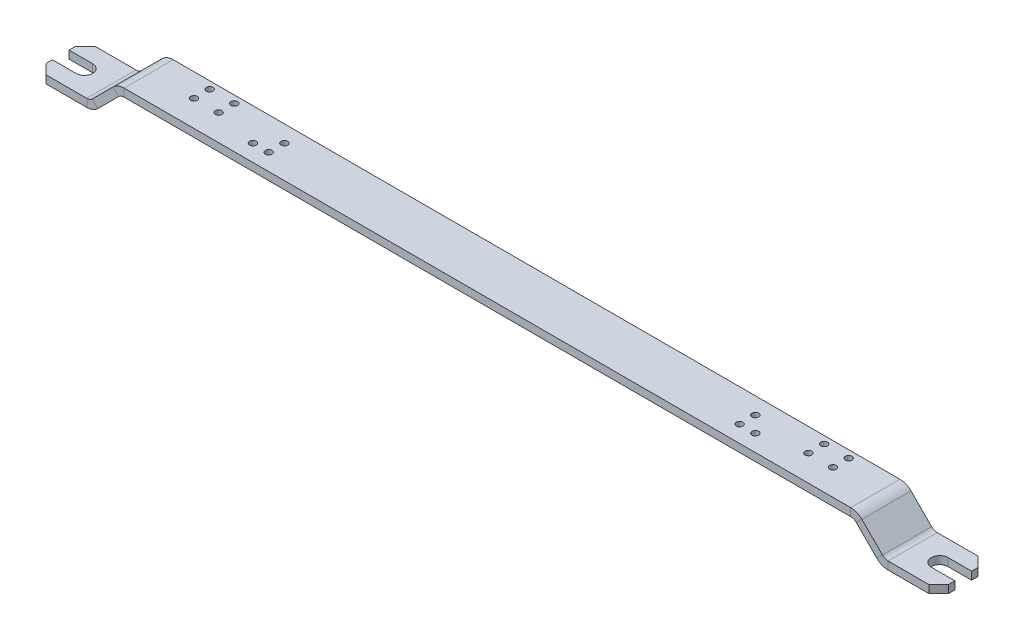
from build123d import *

# Parameters (mm, degrees)
SKETCH_1_W             = 459
SKETCH_1_H             = 50
SM_BASE_FLANGE_1_DEPTH = 8
OTHER_START            = -25
OTHER_1_DEPTH          = 50
OTHER_1_2_DEPTH        = 50
CHAMFER_1_SIZE         = 10
CUT_EXTRUDE_1_DEPTH    = 461.532300713
M8X1_251_D             = 6.8
M8X1_251_CSINK_D       = 8.5
M8X1_251_CSINK_ANGLE   = 90


# Read off the part's stored shape, not the designer's step: Изгиб1
# Sheet-metal steps are written as plain solids
with BuildPart() as part:
    # Sketch 1 → Базовая кромка1 (new body)
    with BuildSketch(Plane(origin=(0, 0, 0), x_dir=(1, 0, 0), z_dir=(0, 1, 0))):
        with Locations((-229.5, 0)):
            Rectangle(SKETCH_1_W, SKETCH_1_H)
    extrude(amount=SM_BASE_FLANGE_1_DEPTH)

    # Other 1 outline → Other 1 (cut)
    with BuildSketch(Plane.XY.offset(OTHER_START)):
        with BuildLine():
            Line((-392.872583002, 8), (-396.186291703, 4.686291703))
            ThreePointArc((-396.186291703, 4.686291703), (-401.377065191, 1.217927743), (-407.5, 2.85e-07))
            Line((-407.5, 2.85e-07), (0, 0))
            Line((0, 0), (0, 8))
            Line((0, 8), (-392.872583002, 8))
        make_face()
    extrude(amount=OTHER_1_DEPTH, mode=Mode.SUBTRACT)

    # Other 1 2 outline → Other 1 2 (add)
    with BuildSketch(Plane.XY.offset(OTHER_START)):
        with BuildLine():
            Line((-407.5, 8.000000285), (-392.872583002, 8))
            Line((-392.872583002, 8), (-375.21572863, 25.656854127))
            ThreePointArc((-375.21572863, 25.656854127), (-372.620341896, 27.3910361), (-369.558874503, 27.999999827))
            Line((-369.558874503, 27.999999827), (0, 28))
            Line((0, 28), (0, 36))
            Line((0, 36), (-369.558874503, 35.999999827))
            ThreePointArc((-369.558874503, 35.999999827), (-375.681809355, 34.78207236), (-380.87258288, 31.313708377))
            Line((-380.87258288, 31.313708377), (-401.843145952, 10.343145952))
            ThreePointArc((-401.843145952, 10.343145952), (-404.43853265, 8.608964003), (-407.5, 8.000000285))
        make_face()
    extrude(amount=OTHER_1_2_DEPTH)

    # Фаска1
    chamfer_1_edges = [part.edges().sort_by_distance(p)[0] for p in [
        (-459, 4, -25),
        (-459, 4, 25),
    ]]
    chamfer(chamfer_1_edges, length=CHAMFER_1_SIZE)

    # Эскиз4 → Вытянуть1 (cut, through all)
    with BuildSketch(Plane(origin=(0, 8, 0), x_dir=(1, 0, 0), z_dir=(0, 1, 0))):
        with BuildLine():
            Line((-435, 8.5), (-459, 8.5))
            Line((-459, 8.5), (-459, -8.5))
            Line((-459, -8.5), (-435, -8.5))
            ThreePointArc((-435, -8.5), (-426.5, 0), (-435, 8.5))
        make_face()
    extrude(amount=-CUT_EXTRUDE_1_DEPTH, mode=Mode.SUBTRACT)

    # Зеркальное отражение1: part across plane


with BuildPart() as part_1:
    add(part.part)
    add(part.part.mirror(Plane(origin=(0, 36, -25), x_dir=(0, 0, 1), z_dir=(-1, 0, 0))))

    # Отверстие обработанное метчиком M8x1.251 (through all)
    with Locations(Plane.XZ.offset(-28)):
        with Locations((-325, -1.5), (-300, -1.5), (-300, -17.5), (-325, -17.5), (300, -1.5), (325, -1.5), (325, -17.5), (300, -17.5), (-255.5, 8), (-239.5, -8), (-239.5, 8), (239.5, 8), (239.5, -8), (255.5, 8)):
            CounterSinkHole(M8X1_251_D / 2, M8X1_251_CSINK_D / 2, counter_sink_angle=M8X1_251_CSINK_ANGLE)


solid = part_1.part
